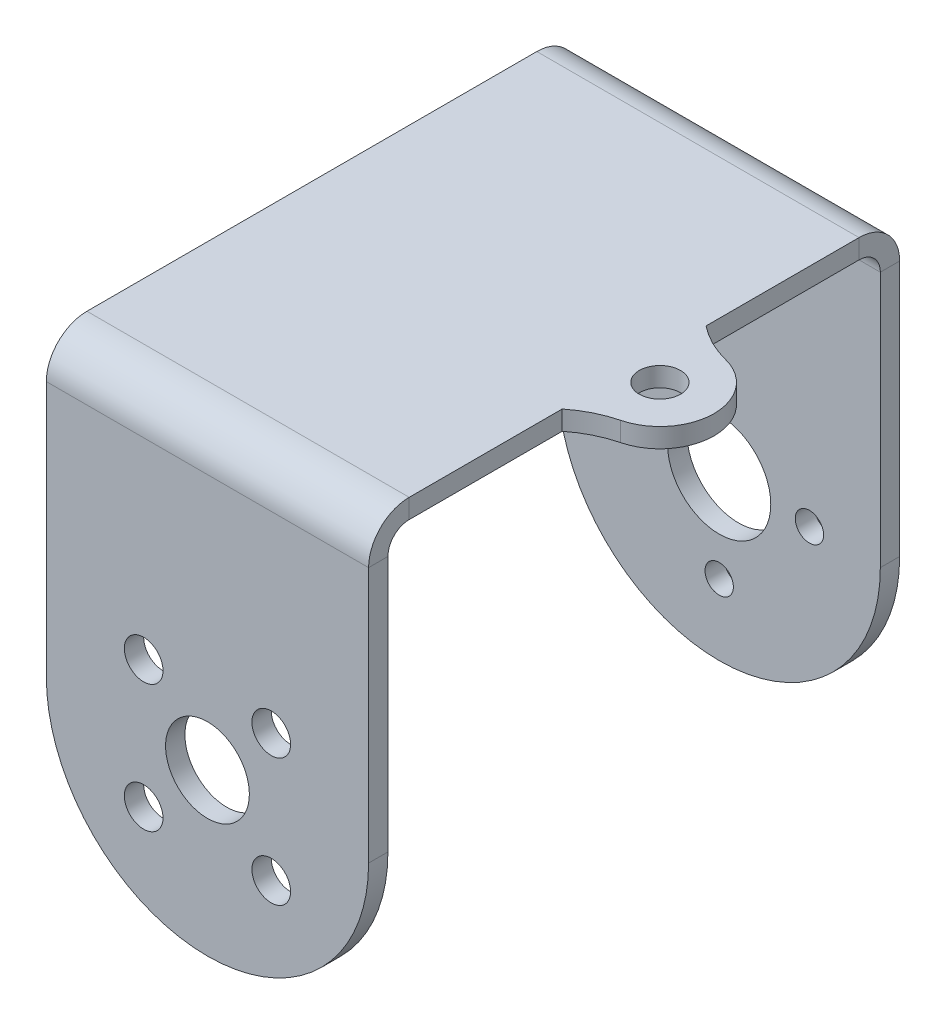
from build123d import *

# Parameters (mm, degrees)
SKETCH1_W                      = 25
SKETCH1_H                      = 38.2
BASE_FLANGE1_DEPTH             = 1.5
EDGE_FLANGE1_STRIP_W           = 9.3
EDGE_FLANGE1_STRIP_H           = 1.5
EDGE_FLANGE1_STRIP_CUT_DEPTH   = 25
EDGE_FLANGE1_STRIP_2_W         = 9.3
EDGE_FLANGE1_STRIP_2_H         = 1.5
EDGE_FLANGE1_STRIP_CUT_2_DEPTH = 25
EDGE_FLANGE1_DEPTH             = 25
EDGE_FLANGE1_BEND_DEPTH        = 25
CUT_EXTRUDE1_REACH             = 57.803
SKETCH12_R                     = 1.5
SKETCH12_R_2                   = 3.25
CUT_EXTRUDE2_REACH             = 57.803
SKETCH13_R                     = 4
SKETCH13_R_2                   = 1.1
FILLET1_R                      = 12.5
SKETCH14_R                     = 1.6
TAB1_DEPTH                     = 1.5


# Sheet-metal steps are written as plain solids
with BuildPart() as part:
    # Sketch1 → Base-Flange1 (new body)
    with BuildSketch(Plane(origin=(0, 0, 0), x_dir=(1, 0, 0), z_dir=(0, 1, 0))):
        Rectangle(SKETCH1_W, SKETCH1_H)
    extrude(amount=-BASE_FLANGE1_DEPTH)

    # Edge-Flange1 strip (across the edge) → Edge-Flange1 strip cut (cut)
    with BuildSketch(Plane(origin=(12.5, -1.5, 19.1), x_dir=(0, 0, -1), z_dir=(-1, 0, 0))):
        with Locations((-3, -0.75)):
            Rectangle(EDGE_FLANGE1_STRIP_W, EDGE_FLANGE1_STRIP_H)
    extrude(amount=EDGE_FLANGE1_STRIP_CUT_DEPTH, mode=Mode.SUBTRACT)

    # Edge-Flange1 strip 2 (across the edge) → Edge-Flange1 strip cut 2 (cut)
    with BuildSketch(Plane(origin=(-12.5, -1.5, -19.1), x_dir=(0, 0, 1), z_dir=(1, 0, 0))):
        with Locations((-3, -0.75)):
            Rectangle(EDGE_FLANGE1_STRIP_2_W, EDGE_FLANGE1_STRIP_2_H)
    extrude(amount=EDGE_FLANGE1_STRIP_CUT_2_DEPTH, mode=Mode.SUBTRACT)

    # Edge-Flange1 section (across the edge) → Edge-Flange1 (add)
    with BuildSketch(Plane(origin=(12.5, -1.5, 19.1), x_dir=(0, 0, -1), z_dir=(-1, 0, 0))):
        with BuildLine():
            Line((-1.5, 1.65), (-1.5, 34))
            Line((-1.5, 34), (0, 34))
            Line((0, 34), (0, 1.65))
            ThreePointArc((0, 1.65), (0.483273811, 0.483273811), (1.65, 0))
            Line((1.65, 0), (1.65, -1.5))
            ThreePointArc((1.65, -1.5), (-0.577386361, -0.577386361), (-1.5, 1.65))
        make_face()
    extrude(amount=EDGE_FLANGE1_DEPTH)

    # Edge-Flange1 section 2 (across the edge) → Edge-Flange1 bend (add)
    with BuildSketch(Plane(origin=(-12.5, -1.5, -19.1), x_dir=(0, 0, 1), z_dir=(1, 0, 0))):
        with BuildLine():
            Line((-1.5, 1.65), (-1.5, 34))
            Line((-1.5, 34), (0, 34))
            Line((0, 34), (0, 1.65))
            ThreePointArc((0, 1.65), (0.483273811, 0.483273811), (1.65, 0))
            Line((1.65, 0), (1.65, -1.5))
            ThreePointArc((1.65, -1.5), (-0.577386361, -0.577386361), (-1.5, 1.65))
        make_face()
    extrude(amount=EDGE_FLANGE1_BEND_DEPTH)

    # Sketch12 → Cut-Extrude1 (cut, up to next)
    with BuildSketch(Plane.XY.offset(20.6), mode=Mode.PRIVATE) as cut_extrude1_sk1:
        with Locations((-4.949747468, -18.050252532)):
            Circle(SKETCH12_R)
    cut_extrude1_tool1 = extrude(cut_extrude1_sk1.sketch, amount=-CUT_EXTRUDE1_REACH, mode=Mode.PRIVATE) & part.part
    # Sketch12 → Cut-Extrude1 (cut, up to next)
    with BuildSketch(Plane.XY.offset(20.6), mode=Mode.PRIVATE) as cut_extrude1_sk2:
        with Locations((4.949747468, -18.050252532)):
            Circle(SKETCH12_R)
    cut_extrude1_tool2 = extrude(cut_extrude1_sk2.sketch, amount=-CUT_EXTRUDE1_REACH, mode=Mode.PRIVATE) & part.part
    # Sketch12 → Cut-Extrude1 (cut, up to next)
    with BuildSketch(Plane.XY.offset(20.6), mode=Mode.PRIVATE) as cut_extrude1_sk3:
        with Locations((-4.949747468, -27.949747468)):
            Circle(SKETCH12_R)
    cut_extrude1_tool3 = extrude(cut_extrude1_sk3.sketch, amount=-CUT_EXTRUDE1_REACH, mode=Mode.PRIVATE) & part.part
    # Sketch12 → Cut-Extrude1 (cut, up to next)
    with BuildSketch(Plane.XY.offset(20.6), mode=Mode.PRIVATE) as cut_extrude1_sk4:
        with Locations((4.949747468, -27.949747468)):
            Circle(SKETCH12_R)
    cut_extrude1_tool4 = extrude(cut_extrude1_sk4.sketch, amount=-CUT_EXTRUDE1_REACH, mode=Mode.PRIVATE) & part.part
    # Sketch12 → Cut-Extrude1 (cut, up to next)
    with BuildSketch(Plane.XY.offset(20.6), mode=Mode.PRIVATE) as cut_extrude1_sk5:
        with Locations((0, -23)):
            Circle(SKETCH12_R_2)
    cut_extrude1_tool5 = extrude(cut_extrude1_sk5.sketch, amount=-CUT_EXTRUDE1_REACH, mode=Mode.PRIVATE) & part.part
    add(cut_extrude1_tool1.solids().sort_by_distance((-4.949747, -18.050253, 20.6))[0], mode=Mode.SUBTRACT)
    add(cut_extrude1_tool2.solids().sort_by_distance((4.949747, -18.050253, 20.6))[0], mode=Mode.SUBTRACT)
    add(cut_extrude1_tool3.solids().sort_by_distance((-4.949747, -27.949747, 20.6))[0], mode=Mode.SUBTRACT)
    add(cut_extrude1_tool4.solids().sort_by_distance((4.949747, -27.949747, 20.6))[0], mode=Mode.SUBTRACT)
    add(cut_extrude1_tool5.solids().sort_by_distance((0, -23, 20.6))[0], mode=Mode.SUBTRACT)

    # Sketch13 → Cut-Extrude2 (cut, up to next)
    with BuildSketch(Plane(origin=(0, 0, -20.6), x_dir=(-1, 0, 0), z_dir=(0, 0, -1)), mode=Mode.PRIVATE) as cut_extrude2_sk1:
        with Locations(Location((0, -23, 0), (0, 0, 90))):
            Circle(SKETCH13_R)
    cut_extrude2_tool1 = extrude(cut_extrude2_sk1.sketch, amount=-CUT_EXTRUDE2_REACH, mode=Mode.PRIVATE) & part.part
    # Sketch13 → Cut-Extrude2 (cut, up to next)
    with BuildSketch(Plane(origin=(0, 0, -20.6), x_dir=(-1, 0, 0), z_dir=(0, 0, -1)), mode=Mode.PRIVATE) as cut_extrude2_sk2:
        with Locations(Location((0, -30, 0), (0, 0, 90))):
            Circle(SKETCH13_R_2)
    cut_extrude2_tool2 = extrude(cut_extrude2_sk2.sketch, amount=-CUT_EXTRUDE2_REACH, mode=Mode.PRIVATE) & part.part
    # Sketch13 → Cut-Extrude2 (cut, up to next)
    with BuildSketch(Plane(origin=(0, 0, -20.6), x_dir=(-1, 0, 0), z_dir=(0, 0, -1)), mode=Mode.PRIVATE) as cut_extrude2_sk3:
        with Locations(Location((-7, -23, 0), (0, 0, 90))):
            Circle(SKETCH13_R_2)
    cut_extrude2_tool3 = extrude(cut_extrude2_sk3.sketch, amount=-CUT_EXTRUDE2_REACH, mode=Mode.PRIVATE) & part.part
    # Sketch13 → Cut-Extrude2 (cut, up to next)
    with BuildSketch(Plane(origin=(0, 0, -20.6), x_dir=(-1, 0, 0), z_dir=(0, 0, -1)), mode=Mode.PRIVATE) as cut_extrude2_sk4:
        with Locations(Location((0, -16, 0), (0, 0, 90))):
            Circle(SKETCH13_R_2)
    cut_extrude2_tool4 = extrude(cut_extrude2_sk4.sketch, amount=-CUT_EXTRUDE2_REACH, mode=Mode.PRIVATE) & part.part
    # Sketch13 → Cut-Extrude2 (cut, up to next)
    with BuildSketch(Plane(origin=(0, 0, -20.6), x_dir=(-1, 0, 0), z_dir=(0, 0, -1)), mode=Mode.PRIVATE) as cut_extrude2_sk5:
        with Locations(Location((7, -23, 0), (0, 0, 90))):
            Circle(SKETCH13_R_2)
    cut_extrude2_tool5 = extrude(cut_extrude2_sk5.sketch, amount=-CUT_EXTRUDE2_REACH, mode=Mode.PRIVATE) & part.part
    add(cut_extrude2_tool1.solids().sort_by_distance((0, -23, -20.6))[0], mode=Mode.SUBTRACT)
    add(cut_extrude2_tool2.solids().sort_by_distance((0, -30, -20.6))[0], mode=Mode.SUBTRACT)
    add(cut_extrude2_tool3.solids().sort_by_distance((7, -23, -20.6))[0], mode=Mode.SUBTRACT)
    add(cut_extrude2_tool4.solids().sort_by_distance((0, -16, -20.6))[0], mode=Mode.SUBTRACT)
    add(cut_extrude2_tool5.solids().sort_by_distance((-7, -23, -20.6))[0], mode=Mode.SUBTRACT)

    # Fillet1
    fillet1_edges = [part.edges().sort_by_distance(p)[0] for p in [
        (12.5, -35.5, 19.85),
        (-12.5, -35.5, 19.85),
        (-12.5, -35.5, -19.85),
        (12.5, -35.5, -19.85),
    ]]
    fillet(fillet1_edges, radius=FILLET1_R - 0.0001)  # a hair under: the kernel refuses the full size

    # Sketch14 → Tab1 (add)
    with BuildSketch(Plane.XZ.offset(1.5)):
        with BuildLine():
            Line((12.5, -5.581701947), (12.5, 5.581701947))
            ThreePointArc((12.5, 5.581701947), (13.935678731, 4.66460431), (15.532990604, 4.072289972))
            ThreePointArc((15.532990604, 4.072289972), (18.701263524, 0), (15.532990604, -4.072289972))
            ThreePointArc((15.532990604, -4.072289972), (13.935678731, -4.66460431), (12.5, -5.581701947))
        make_face()
        with Locations(Location((14.5, 0, 0), (0, 0, 270))):
            Circle(SKETCH14_R, mode=Mode.SUBTRACT)
    extrude(amount=-TAB1_DEPTH)


solid = part.part
